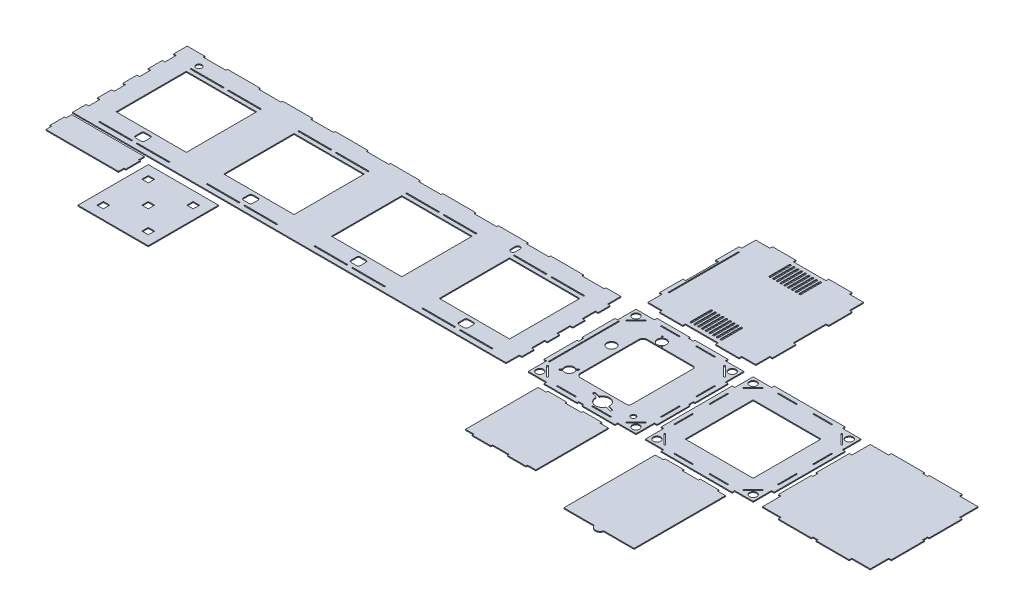
from build123d import *

# Parameters (mm, degrees)
BOSS_EXTRUDE1_DEPTH   = 2.54
SKETCH5_R             = 7.9375
SKETCH5_W             = 190.5
SKETCH5_H             = 3.1242
SKETCH5_H_2           = 190.5
CUT_EXTRUDE2_DEPTH    = 754.599861511
BOSS_EXTRUDE2_DEPTH   = 2.54
SKETCH6_W             = 184.15
SKETCH6_H             = 184.15
BOSS_EXTRUDE2_2_DEPTH = 2.54
BOSS_EXTRUDE2_3_DEPTH = 2.54
BOSS_EXTRUDE3_DEPTH   = 2.54
SKETCH8_R             = 10
CUT_EXTRUDE3_DEPTH    = 1442.914068337
SKETCH9_W             = 190.5
SKETCH9_H             = 190.5
SKETCH9_W_2           = 17.272
SKETCH9_H_2           = 17.272
BOSS_EXTRUDE4_DEPTH   = 2.54
SKETCH11_R            = 12.6875032
SKETCH11_R_2          = 1.7054957
SKETCH11_R_3          = 6.747379022
CUT_EXTRUDE4_DEPTH    = 1470.492237295
SKETCH12_W            = 2.921
SKETCH12_H            = 50.8
SKETCH12_W_2          = 50.8
SKETCH12_H_2          = 2.921
CUT_EXTRUDE5_DEPTH    = 1470.492237295
SKETCH13_W            = 2.921
SKETCH13_H            = 190.5
CUT_EXTRUDE6_DEPTH    = 1470.492237295
BOSS_EXTRUDE5_DEPTH   = 2.54
SKETCH14_W            = 2.921
SKETCH14_H            = 190.5
BOSS_EXTRUDE5_2_DEPTH = 2.54
BOSS_EXTRUDE5_3_DEPTH = 2.54
SKETCH15_W            = 61.214
SKETCH15_H            = 4.445
CUT_EXTRUDE7_DEPTH    = 1502.22101135
SKETCH16_W            = 12.7
SKETCH16_H            = 3.1242
BOSS_EXTRUDE6_DEPTH   = 2.54
SKETCH17_W            = 13.335
SKETCH17_H            = 4.445
SKETCH17_W_2          = 4.445
SKETCH17_H_2          = 13.335
CUT_EXTRUDE8_DEPTH    = 1502.22101135


with BuildPart() as part:
    # Sketch1 → Boss-Extrude1 (new body)
    with BuildSketch(Plane(origin=(0, 0, 0), x_dir=(1, 0, 0), z_dir=(0, 1, 0))):
        Polygon((146.05, 155.575), (438.15, 155.575), (438.15, 119.6594), (445.262, 119.6594), (445.262, 86.7664), (438.15, 86.7664), (438.15, 50.8508), (445.262, 50.8508), (445.262, 17.9578), (438.15, 17.9578), (438.15, -17.9578), (445.262, -17.9578), (445.262, -50.8508), (438.15, -50.8508), (438.15, -86.7664), (445.262, -86.7664), (445.262, -119.6594), (438.15, -119.6594), (438.15, -155.575), (146.05, -155.575), (-146.05, -155.575), (-438.15, -155.575), (-730.25, -155.575), (-737.362, -155.575), (-737.362, -118.4529), (-730.25, -118.4529), (-730.25, -87.9729), (-737.362, -87.9729), (-737.362, -49.6443), (-730.25, -49.6443), (-730.25, -19.1643), (-737.362, -19.1643), (-737.362, 19.1643), (-730.25, 19.1643), (-730.25, 49.6443), (-737.362, 49.6443), (-737.362, 87.9729), (-730.25, 87.9729), (-730.25, 118.4529), (-737.362, 118.4529), (-737.362, 155.575), (-730.25, 155.575), (-438.15, 155.575), (-146.05, 155.575), align=None)
    extrude(amount=BOSS_EXTRUDE1_DEPTH)

    # Sketch5 → Cut-Extrude2 (cut, through all)
    with BuildSketch(Plane(origin=(0, 2.54, 0), x_dir=(1, 0, 0), z_dir=(0, 1, 0))):
        with Locations((-673.862, 123.7742)):
            Circle(SKETCH5_R)
        with Locations((-584.2, -141.3129)):
            Rectangle(SKETCH5_W, SKETCH5_H)
        with Locations((-292.1, -141.3129)):
            Rectangle(SKETCH5_W, SKETCH5_H)
        with Locations((0, -141.3129)):
            Rectangle(SKETCH5_W, SKETCH5_H)
        with Locations((292.1, -141.3129)):
            Rectangle(SKETCH5_W, SKETCH5_H)
        with Locations((-584.2, 0)):
            Rectangle(SKETCH5_W, SKETCH5_H_2)
        with Locations((-292.1, 0)):
            Rectangle(SKETCH5_W, SKETCH5_H_2)
        Rectangle(SKETCH5_W, SKETCH5_H_2)
        with Locations((292.1, 0)):
            Rectangle(SKETCH5_W, SKETCH5_H_2)
        with Locations((-584.2, 106.9721)):
            Rectangle(SKETCH5_W, SKETCH5_H)
        with Locations((-292.1, 106.9721)):
            Rectangle(SKETCH5_W, SKETCH5_H)
        with Locations((0, 106.9721)):
            Rectangle(SKETCH5_W, SKETCH5_H)
        with Locations((292.1, 106.9721)):
            Rectangle(SKETCH5_W, SKETCH5_H)
        with BuildLine():
            Line((-7.62, -130.2258), (7.62, -130.2258))
            ThreePointArc((7.62, -130.2258), (11.212102448, -128.737902448), (12.7, -125.1458))
            Line((12.7, -125.1458), (12.7, -109.855))
            ThreePointArc((12.7, -109.855), (11.212102448, -106.262897552), (7.62, -104.775))
            Line((7.62, -104.775), (-7.62, -104.775))
            ThreePointArc((-7.62, -104.775), (-11.212102448, -106.262897552), (-12.7, -109.855))
            Line((-12.7, -109.855), (-12.7, -125.1458))
            ThreePointArc((-12.7, -125.1458), (-11.212102448, -128.737902448), (-7.62, -130.2258))
        make_face()
        with BuildLine():
            Line((-299.72, -104.775), (-284.48, -104.775))
            ThreePointArc((-284.48, -104.775), (-280.887897552, -106.262897552), (-279.4, -109.855))
            Line((-279.4, -109.855), (-279.4, -125.1458))
            ThreePointArc((-279.4, -125.1458), (-280.887897552, -128.737902448), (-284.48, -130.2258))
            Line((-284.48, -130.2258), (-299.72, -130.2258))
            ThreePointArc((-299.72, -130.2258), (-303.312102448, -128.737902448), (-304.8, -125.1458))
            Line((-304.8, -125.1458), (-304.8, -109.855))
            ThreePointArc((-304.8, -109.855), (-303.312102448, -106.262897552), (-299.72, -104.775))
        make_face()
        with BuildLine():
            Line((284.48, -130.2258), (299.72, -130.2258))
            ThreePointArc((299.72, -130.2258), (303.312102448, -128.737902448), (304.8, -125.1458))
            Line((304.8, -125.1458), (304.8, -109.855))
            ThreePointArc((304.8, -109.855), (303.312102448, -106.262897552), (299.72, -104.775))
            Line((299.72, -104.775), (284.48, -104.775))
            ThreePointArc((284.48, -104.775), (280.887897552, -106.262897552), (279.4, -109.855))
            Line((279.4, -109.855), (279.4, -125.1458))
            ThreePointArc((279.4, -125.1458), (280.887897552, -128.737902448), (284.48, -130.2258))
        make_face()
        with BuildLine():
            Line((-596.9, -109.855), (-596.9, -125.1458))
            ThreePointArc((-596.9, -125.1458), (-595.412102448, -128.737902448), (-591.82, -130.2258))
            Line((-591.82, -130.2258), (-576.58, -130.2258))
            ThreePointArc((-576.58, -130.2258), (-572.987897552, -128.737902448), (-571.5, -125.1458))
            Line((-571.5, -125.1458), (-571.5, -109.855))
            ThreePointArc((-571.5, -109.855), (-572.987897552, -106.262897552), (-576.58, -104.775))
            Line((-576.58, -104.775), (-591.82, -104.775))
            ThreePointArc((-591.82, -104.775), (-595.412102448, -106.262897552), (-596.9, -109.855))
        make_face()
        with BuildLine():
            Line((190.5, 130.1242), (190.5, 117.4242))
            ThreePointArc((190.5, 117.4242), (184.15, 111.0742), (177.8, 117.4242))
            Line((177.8, 117.4242), (177.8, 130.1242))
            ThreePointArc((177.8, 130.1242), (184.15, 136.4742), (190.5, 130.1242))
        make_face()
    extrude(amount=-CUT_EXTRUDE2_DEPTH, mode=Mode.SUBTRACT)

    # Sketch15 → Cut-Extrude7 (cut, through all)
    with BuildSketch(Plane(origin=(0, 2.54, 0), x_dir=(1, 0, 0), z_dir=(0, 1, 0))):
        with Locations((217.043, 153.3525)):
            Rectangle(SKETCH15_W, SKETCH15_H)
        with Locations((367.157, 153.3525)):
            Rectangle(SKETCH15_W, SKETCH15_H)
        with Locations((-75.057, 153.3525)):
            Rectangle(SKETCH15_W, SKETCH15_H)
        with Locations((75.057, 153.3525)):
            Rectangle(SKETCH15_W, SKETCH15_H)
        with Locations((-367.157, 153.3525)):
            Rectangle(SKETCH15_W, SKETCH15_H)
        with Locations((-217.043, 153.3525)):
            Rectangle(SKETCH15_W, SKETCH15_H)
        with Locations((-659.257, 153.3525)):
            Rectangle(SKETCH15_W, SKETCH15_H)
        with Locations((-509.143, 153.3525)):
            Rectangle(SKETCH15_W, SKETCH15_H)
    extrude(amount=-CUT_EXTRUDE7_DEPTH, mode=Mode.SUBTRACT)

    # Sketch16 → Boss-Extrude6 (add)
    with BuildSketch(Plane(origin=(0, 2.54, 0), x_dir=(1, 0, 0), z_dir=(0, 1, 0))):
        with Locations((-584.2, 106.9721)):
            Rectangle(SKETCH16_W, SKETCH16_H)
        with Locations((-292.1, 106.9721)):
            Rectangle(SKETCH16_W, SKETCH16_H)
        with Locations((-584.2, -141.3129)):
            Rectangle(SKETCH16_W, SKETCH16_H)
        with Locations((-292.1, -141.3129)):
            Rectangle(SKETCH16_W, SKETCH16_H)
        with Locations((0, 106.9721)):
            Rectangle(SKETCH16_W, SKETCH16_H)
        with Locations((0, -141.3129)):
            Rectangle(SKETCH16_W, SKETCH16_H)
        with Locations((292.1, 106.9721)):
            Rectangle(SKETCH16_W, SKETCH16_H)
        with Locations((292.1, -141.3129)):
            Rectangle(SKETCH16_W, SKETCH16_H)
    extrude(amount=-BOSS_EXTRUDE6_DEPTH)


with BuildPart() as body_2:
    # Sketch6 → Boss-Extrude2 (new body)
    with BuildSketch(Plane(origin=(0, 0, 0), x_dir=(1, 0, 0), z_dir=(0, 1, 0))):
        Polygon((488.95, 96.139), (488.95, 146.05), (538.861, 146.05), (538.861, 153.162), (731.139, 153.162), (731.139, 146.05), (781.05, 146.05), (781.05, 96.139), (788.162, 96.139), (788.162, -96.139), (781.05, -96.139), (781.05, -146.05), (731.139, -146.05), (731.139, -153.162), (538.861, -153.162), (538.861, -146.05), (488.95, -146.05), (488.95, -96.139), (481.838, -96.139), (481.838, 96.139), align=None)
    extrude(amount=BOSS_EXTRUDE2_DEPTH)


with BuildPart() as body_3:
    # Sketch6 → Boss-Extrude2 2 (new body)
    with BuildSketch(Plane(origin=(0, 0, 0), x_dir=(1, 0, 0), z_dir=(0, 1, 0))):
        Polygon((799.338, 96.139), (799.338, -96.139), (806.45, -96.139), (806.45, -146.05), (856.361, -146.05), (856.361, -153.162), (1048.639, -153.162), (1048.639, -146.05), (1098.55, -146.05), (1098.55, -96.139), (1105.662, -96.139), (1105.662, 96.139), (1098.55, 96.139), (1098.55, 146.05), (1048.639, 146.05), (1048.639, 153.162), (856.361, 153.162), (856.361, 146.05), (806.45, 146.05), (806.45, 96.139), align=None)
        with Locations((952.5, 0)):
            Rectangle(SKETCH6_W, SKETCH6_H, mode=Mode.SUBTRACT)
    extrude(amount=BOSS_EXTRUDE2_2_DEPTH)


with BuildPart() as body_4:
    # Sketch6 → Boss-Extrude2 3 (new body)
    with BuildSketch(Plane(origin=(0, 0, 0), x_dir=(1, 0, 0), z_dir=(0, 1, 0))):
        Polygon((1116.838, 96.139), (1116.838, -96.139), (1123.95, -96.139), (1123.95, -146.05), (1173.861, -146.05), (1173.861, -153.162), (1366.139, -153.162), (1366.139, -146.05), (1416.05, -146.05), (1416.05, -96.139), (1423.162, -96.139), (1423.162, 96.139), (1416.05, 96.139), (1416.05, 146.05), (1366.139, 146.05), (1366.139, 153.162), (1173.861, 153.162), (1173.861, 146.05), (1123.95, 146.05), (1123.95, 96.139), align=None)
    extrude(amount=BOSS_EXTRUDE2_3_DEPTH)


with BuildPart() as body_5:
    # Sketch7 → Boss-Extrude3 (new body)
    with BuildSketch(Plane(origin=(0, 0, 0), x_dir=(1, 0, 0), z_dir=(0, 1, 0))):
        Polygon((-732.917, -161.925), (-536.321, -161.925), (-536.321, -177.165), (-531.876, -177.165), (-531.876, -216.535), (-536.321, -216.535), (-536.321, -231.775), (-732.917, -231.775), (-732.917, -216.535), (-737.362, -216.535), (-737.362, -177.165), (-732.917, -177.165), align=None)
    extrude(amount=BOSS_EXTRUDE3_DEPTH)


with BuildPart() as cut_extrude3_tool:
    # Sketch8 → Cut-Extrude3 (new, through all)
    with BuildSketch(Plane(origin=(0, 2.54, 0), x_dir=(1, 0, 0), z_dir=(0, 1, 0))):
        with Locations((822.165448212, 130.334551788)):
            Circle(SKETCH8_R)
        with Locations((1082.834551788, 130.334551788)):
            Circle(SKETCH8_R)
        with Locations((1082.834551788, -130.334551788)):
            Circle(SKETCH8_R)
        with Locations((822.165448212, -130.334551788)):
            Circle(SKETCH8_R)
        with Locations((504.665448212, 130.334551788)):
            Circle(SKETCH8_R)
        with Locations((765.334551788, 130.334551788)):
            Circle(SKETCH8_R)
        with Locations((765.334551788, -130.334551788)):
            Circle(SKETCH8_R)
        with Locations((504.665448212, -130.334551788)):
            Circle(SKETCH8_R)
        Polygon((500.435115818, -107.624115818), (527.375884182, -134.564884182), (529.585027187, -132.355741176), (502.644258824, -105.414972813), align=None)
        Polygon((529.585027187, 132.355741176), (502.644258824, 105.414972813), (500.435115818, 107.624115818), (527.375884182, 134.564884182), align=None)
        Polygon((767.355741176, 105.414972813), (740.414972813, 132.355741176), (742.624115818, 134.564884182), (769.564884182, 107.624115818), align=None)
        Polygon((740.414972813, -132.355741176), (767.355741176, -105.414972813), (769.564884182, -107.624115818), (742.624115818, -134.564884182), align=None)
        Polygon((817.935115818, -107.624115818), (820.144258824, -105.414972813), (847.085027187, -132.355741176), (844.875884182, -134.564884182), align=None)
        Polygon((820.144258824, 105.414972813), (817.935115818, 107.624115818), (844.875884182, 134.564884182), (847.085027187, 132.355741176), align=None)
        Polygon((1057.914972813, 132.355741176), (1060.124115818, 134.564884182), (1087.064884182, 107.624115818), (1084.855741176, 105.414972813), align=None)
        Polygon((1084.855741176, -105.414972813), (1087.064884182, -107.624115818), (1060.124115818, -134.564884182), (1057.914972813, -132.355741176), align=None)
    extrude(amount=-CUT_EXTRUDE3_DEPTH)


with BuildPart() as body_2_1:
    add(body_2.part)

    # Cut-Extrude3: cut by cut_extrude3_tool
    add(cut_extrude3_tool.part, mode=Mode.SUBTRACT)

    # Sketch11 → Cut-Extrude4 (cut, through all)
    with BuildSketch(Plane(origin=(0, 2.54, 0), x_dir=(1, 0, 0), z_dir=(0, 1, 0))):
        with Locations((540.385, 28.067)):
            Circle(SKETCH11_R)
        with Locations((600.584397, 104.3237436)):
            Circle(SKETCH11_R)
        with Locations((612.380792, 93.3292393)):
            Circle(SKETCH11_R_2)
        with Locations((588.3905174, 117.3172406)):
            Circle(SKETCH11_R_2)
        with Locations((737.057200001, -109.220000002)):
            Circle(SKETCH11_R_3)
        with BuildLine():
            Line((679.001218905, -124.538259876), (690.502378135, -127.619986202))
            ThreePointArc((690.502378135, -127.619986202), (694.235400503, -125.464724733), (692.080139033, -121.731702364))
            Line((692.080139033, -121.731702364), (680.578979804, -118.649976037))
            ThreePointArc((680.578979804, -118.649976037), (679.882033046, -118.172215085), (679.639114424, -117.362906211))
            ThreePointArc((679.639114424, -117.362906211), (665.550382, -98.069523592), (643.702490503, -107.733716851))
            ThreePointArc((643.702490503, -107.733716851), (643.087462368, -108.313139585), (642.245008295, -108.378419327))
            Line((642.245008295, -108.378419327), (630.743849064, -105.296693))
            ThreePointArc((630.743849064, -105.296693), (627.010826696, -107.451954469), (629.166088165, -111.184976837))
            Line((629.166088165, -111.184976837), (640.667247395, -114.266703165))
            ThreePointArc((640.667247395, -114.266703165), (641.364194153, -114.744464117), (641.607112775, -115.553772991))
            ThreePointArc((641.607112775, -115.553772991), (652.618847339, -133.731389412), (673.606119056, -130.381992048))
            ThreePointArc((673.606119056, -130.381992048), (675.79922073, -127.952351108), (677.543736697, -125.182962351))
            ThreePointArc((677.543736697, -125.182962351), (678.158764831, -124.603539618), (679.001218905, -124.538259876))
        make_face()
        with BuildLine():
            Line((551.677072903, -78.533766145), (554.425437911, -75.785401137))
            ThreePointArc((554.425437911, -75.785401137), (554.425437911, -72.193298689), (550.833335463, -72.193298689))
            Line((550.833335463, -72.193298689), (548.084970455, -74.941663697))
            ThreePointArc((548.084970455, -74.941663697), (547.361951275, -75.30152232), (546.568159689, -75.15269396))
            ThreePointArc((546.568159689, -75.15269396), (531.414977451, -77.260920051), (529.30675136, -92.414102289))
            ThreePointArc((529.30675136, -92.414102289), (529.45557972, -93.207893875), (529.095721097, -93.930913055))
            Line((529.095721097, -93.930913055), (526.347356089, -96.679278063))
            ThreePointArc((526.347356089, -96.679278063), (526.347356089, -100.271380511), (529.939458537, -100.271380511))
            Line((529.939458537, -100.271380511), (532.687823545, -97.523015503))
            ThreePointArc((532.687823545, -97.523015503), (533.410842725, -97.16315688), (534.204634311, -97.31198524))
            ThreePointArc((534.204634311, -97.31198524), (549.357816549, -95.203759149), (551.46604264, -80.050576911))
            ThreePointArc((551.46604264, -80.050576911), (551.31721428, -79.256785325), (551.677072903, -78.533766145))
        make_face()
        with BuildLine():
            Line((699.863001735, 90.322743515), (574.863001758, 90.322743515))
            ThreePointArc((574.863001758, 90.322743515), (566.871456828, 87.01253722), (563.561250533, 79.02099229))
            Line((563.561250533, 79.02099229), (563.561250533, -78.979005984))
            ThreePointArc((563.561250533, -78.979005984), (566.871456828, -86.970550914), (574.863001758, -90.280757208))
            Line((574.863001758, -90.280757208), (699.863001735, -90.280757208))
            ThreePointArc((699.863001735, -90.280757208), (704.319011668, -88.435017459), (706.164751417, -83.979007526))
            Line((706.164751417, -83.979007526), (706.164751417, 84.020993832))
            ThreePointArc((706.164751417, 84.020993832), (704.319011668, 88.477003766), (699.863001735, 90.322743515))
        make_face()
    extrude(amount=-CUT_EXTRUDE4_DEPTH, mode=Mode.SUBTRACT)


with BuildPart() as body_3_1:
    add(body_3.part)

    # Cut-Extrude3: cut by cut_extrude3_tool
    add(cut_extrude3_tool.part, mode=Mode.SUBTRACT)


with BuildPart() as body_6:
    # Sketch9 → Boss-Extrude4 (new body)
    with BuildSketch(Plane(origin=(0, 0, 0), x_dir=(1, 0, 0), z_dir=(0, 1, 0))):
        with Locations((-416.626, -270.825)):
            Rectangle(SKETCH9_W, SKETCH9_H)
        with Locations((-416.626, -270.825)):
            Rectangle(SKETCH9_W_2, SKETCH9_H_2, mode=Mode.SUBTRACT)
        with Locations((-477.524727194, -209.926272806)):
            Rectangle(SKETCH9_W_2, SKETCH9_H_2, mode=Mode.SUBTRACT)
        with Locations((-477.524727194, -331.723727194)):
            Rectangle(SKETCH9_W_2, SKETCH9_H_2, mode=Mode.SUBTRACT)
        with Locations((-355.727272806, -331.723727194)):
            Rectangle(SKETCH9_W_2, SKETCH9_H_2, mode=Mode.SUBTRACT)
        with Locations((-355.727272806, -209.926272806)):
            Rectangle(SKETCH9_W_2, SKETCH9_H_2, mode=Mode.SUBTRACT)
    extrude(amount=BOSS_EXTRUDE4_DEPTH)


with BuildPart() as cut_extrude5_tool:
    # Sketch12 → Cut-Extrude5 (new, through all)
    with BuildSketch(Plane(origin=(0, 2.54, 0), x_dir=(1, 0, 0), z_dir=(0, 1, 0))):
        with Locations((494.0935, -47.621851794)):
            Rectangle(SKETCH12_W, SKETCH12_H)
        with Locations((494.0935, 47.628148206)):
            Rectangle(SKETCH12_W, SKETCH12_H)
        with Locations((682.628148206, 140.9065)):
            Rectangle(SKETCH12_W_2, SKETCH12_H_2)
        with Locations((587.378148206, 140.9065)):
            Rectangle(SKETCH12_W_2, SKETCH12_H_2)
        with Locations((775.9065, -47.628148206)):
            Rectangle(SKETCH12_W, SKETCH12_H)
        with Locations((775.9065, 47.621851794)):
            Rectangle(SKETCH12_W, SKETCH12_H)
        with Locations((587.371851794, -140.9065)):
            Rectangle(SKETCH12_W_2, SKETCH12_H_2)
        with Locations((682.621851794, -140.9065)):
            Rectangle(SKETCH12_W_2, SKETCH12_H_2)
        with Locations((811.5935, 47.628148206)):
            Rectangle(SKETCH12_W, SKETCH12_H)
        with Locations((811.5935, -47.621851794)):
            Rectangle(SKETCH12_W, SKETCH12_H)
        with Locations((1000.128148206, 140.9065)):
            Rectangle(SKETCH12_W_2, SKETCH12_H_2)
        with Locations((904.878148206, 140.9065)):
            Rectangle(SKETCH12_W_2, SKETCH12_H_2)
        with Locations((1093.4065, -47.628148206)):
            Rectangle(SKETCH12_W, SKETCH12_H)
        with Locations((1093.4065, 47.621851794)):
            Rectangle(SKETCH12_W, SKETCH12_H)
        with Locations((904.871851794, -140.9065)):
            Rectangle(SKETCH12_W_2, SKETCH12_H_2)
        with Locations((1000.121851794, -140.9065)):
            Rectangle(SKETCH12_W_2, SKETCH12_H_2)
    extrude(amount=-CUT_EXTRUDE5_DEPTH)


with BuildPart() as body_2_2:
    add(body_2_1.part)

    # Cut-Extrude5: cut by cut_extrude5_tool
    add(cut_extrude5_tool.part, mode=Mode.SUBTRACT)

    # Sketch13 → Cut-Extrude6 (cut, through all)
    with BuildSketch(Plane(origin=(0, 2.54, 0), x_dir=(1, 0, 0), z_dir=(0, 1, 0))):
        with Locations((494.0935, 0.003148206)):
            Rectangle(SKETCH13_W, SKETCH13_H)
    extrude(amount=-CUT_EXTRUDE6_DEPTH, mode=Mode.SUBTRACT)


with BuildPart() as body_3_2:
    add(body_3_1.part)

    # Cut-Extrude5: cut by cut_extrude5_tool
    add(cut_extrude5_tool.part, mode=Mode.SUBTRACT)


with BuildPart() as body_7:
    # Sketch14 → Boss-Extrude5 (new body)
    with BuildSketch(Plane(origin=(0, 0, 0), x_dir=(1, 0, 0), z_dir=(0, 1, 0))):
        Polygon((539.746851794, -170.307), (561.971851794, -170.307), (561.971851794, -165.862), (612.771851794, -165.862), (612.771851794, -170.307), (657.221851794, -170.307), (657.221851794, -165.862), (708.021851794, -165.862), (708.021851794, -170.307), (730.246851794, -170.307), (730.246851794, -366.903), (708.021851794, -366.903), (708.021851794, -371.348), (657.221851794, -371.348), (657.221851794, -366.903), (612.771851794, -366.903), (612.771851794, -371.348), (561.971851794, -371.348), (561.971851794, -366.903), (539.746851794, -366.903), align=None)
    extrude(amount=BOSS_EXTRUDE5_DEPTH)


with BuildPart() as body_8:
    # Sketch14 → Boss-Extrude5 2 (new body)
    with BuildSketch(Plane(origin=(0, 0, 0), x_dir=(1, 0, 0), z_dir=(0, 1, 0))):
        Polygon((488.95, 470.662), (527.05, 470.662), (527.05, 477.774), (590.55, 477.774), (590.55, 470.662), (679.45, 470.662), (679.45, 477.774), (742.95, 477.774), (742.95, 470.662), (781.05, 470.662), (781.05, 432.562), (788.162, 432.562), (788.162, 369.062), (781.05, 369.062), (781.05, 280.162), (788.162, 280.162), (788.162, 216.662), (781.05, 216.662), (781.05, 178.562), (742.95, 178.562), (742.95, 171.45), (679.45, 171.45), (679.45, 178.562), (590.55, 178.562), (590.55, 171.45), (527.05, 171.45), (527.05, 178.562), (488.95, 178.562), (488.95, 216.662), (481.838, 216.662), (481.838, 280.162), (488.95, 280.162), (488.95, 369.062), (481.838, 369.062), (481.838, 432.562), (488.95, 432.562), align=None)
        with BuildLine():
            Line((632.46, 244.9068), (632.46, 190.9318))
            ThreePointArc((632.46, 190.9318), (635, 188.3918), (637.54, 190.9318))
            Line((637.54, 190.9318), (637.54, 244.9068))
            ThreePointArc((637.54, 244.9068), (635, 247.4468), (632.46, 244.9068))
        make_face(mode=Mode.SUBTRACT)
        with BuildLine():
            Line((632.46, 404.3172), (632.46, 458.2922))
            ThreePointArc((632.46, 458.2922), (635, 460.8322), (637.54, 458.2922))
            Line((637.54, 458.2922), (637.54, 404.3172))
            ThreePointArc((637.54, 404.3172), (635, 401.7772), (632.46, 404.3172))
        make_face(mode=Mode.SUBTRACT)
        with BuildLine():
            Line((642.62, 404.3172), (642.62, 458.2922))
            ThreePointArc((642.62, 458.2922), (645.16, 460.8322), (647.7, 458.2922))
            Line((647.7, 458.2922), (647.7, 404.3172))
            ThreePointArc((647.7, 404.3172), (645.16, 401.7772), (642.62, 404.3172))
        make_face(mode=Mode.SUBTRACT)
        with BuildLine():
            Line((642.62, 244.9068), (642.62, 190.9318))
            ThreePointArc((642.62, 190.9318), (645.16, 188.3918), (647.7, 190.9318))
            Line((647.7, 190.9318), (647.7, 244.9068))
            ThreePointArc((647.7, 244.9068), (645.16, 247.4468), (642.62, 244.9068))
        make_face(mode=Mode.SUBTRACT)
        with BuildLine():
            Line((652.78, 404.3172), (652.78, 458.2922))
            ThreePointArc((652.78, 458.2922), (655.32, 460.8322), (657.86, 458.2922))
            Line((657.86, 458.2922), (657.86, 404.3172))
            ThreePointArc((657.86, 404.3172), (655.32, 401.7772), (652.78, 404.3172))
        make_face(mode=Mode.SUBTRACT)
        with BuildLine():
            Line((652.78, 244.9068), (652.78, 190.9318))
            ThreePointArc((652.78, 190.9318), (655.32, 188.3918), (657.86, 190.9318))
            Line((657.86, 190.9318), (657.86, 244.9068))
            ThreePointArc((657.86, 244.9068), (655.32, 247.4468), (652.78, 244.9068))
        make_face(mode=Mode.SUBTRACT)
        with BuildLine():
            Line((662.94, 404.3172), (662.94, 458.2922))
            ThreePointArc((662.94, 458.2922), (665.48, 460.8322), (668.02, 458.2922))
            Line((668.02, 458.2922), (668.02, 404.3172))
            ThreePointArc((668.02, 404.3172), (665.48, 401.7772), (662.94, 404.3172))
        make_face(mode=Mode.SUBTRACT)
        with BuildLine():
            Line((662.94, 244.9068), (662.94, 190.9318))
            ThreePointArc((662.94, 190.9318), (665.48, 188.3918), (668.02, 190.9318))
            Line((668.02, 190.9318), (668.02, 244.9068))
            ThreePointArc((668.02, 244.9068), (665.48, 247.4468), (662.94, 244.9068))
        make_face(mode=Mode.SUBTRACT)
        with BuildLine():
            Line((673.1, 404.3172), (673.1, 458.2922))
            ThreePointArc((673.1, 458.2922), (675.64, 460.8322), (678.18, 458.2922))
            Line((678.18, 458.2922), (678.18, 404.3172))
            ThreePointArc((678.18, 404.3172), (675.64, 401.7772), (673.1, 404.3172))
        make_face(mode=Mode.SUBTRACT)
        with BuildLine():
            Line((673.1, 244.9068), (673.1, 190.9318))
            ThreePointArc((673.1, 190.9318), (675.64, 188.3918), (678.18, 190.9318))
            Line((678.18, 190.9318), (678.18, 244.9068))
            ThreePointArc((678.18, 244.9068), (675.64, 247.4468), (673.1, 244.9068))
        make_face(mode=Mode.SUBTRACT)
        with BuildLine():
            Line((622.3, 404.3172), (622.3, 458.2922))
            ThreePointArc((622.3, 458.2922), (624.84, 460.8322), (627.38, 458.2922))
            Line((627.38, 458.2922), (627.38, 404.3172))
            ThreePointArc((627.38, 404.3172), (624.84, 401.7772), (622.3, 404.3172))
        make_face(mode=Mode.SUBTRACT)
        with BuildLine():
            Line((622.3, 244.9068), (622.3, 190.9318))
            ThreePointArc((622.3, 190.9318), (624.84, 188.3918), (627.38, 190.9318))
            Line((627.38, 190.9318), (627.38, 244.9068))
            ThreePointArc((627.38, 244.9068), (624.84, 247.4468), (622.3, 244.9068))
        make_face(mode=Mode.SUBTRACT)
        with BuildLine():
            Line((612.14, 404.3172), (612.14, 458.2922))
            ThreePointArc((612.14, 458.2922), (614.68, 460.8322), (617.22, 458.2922))
            Line((617.22, 458.2922), (617.22, 404.3172))
            ThreePointArc((617.22, 404.3172), (614.68, 401.7772), (612.14, 404.3172))
        make_face(mode=Mode.SUBTRACT)
        with BuildLine():
            Line((612.14, 244.9068), (612.14, 190.9318))
            ThreePointArc((612.14, 190.9318), (614.68, 188.3918), (617.22, 190.9318))
            Line((617.22, 190.9318), (617.22, 244.9068))
            ThreePointArc((617.22, 244.9068), (614.68, 247.4468), (612.14, 244.9068))
        make_face(mode=Mode.SUBTRACT)
        with BuildLine():
            Line((601.98, 404.3172), (601.98, 458.2922))
            ThreePointArc((601.98, 458.2922), (604.52, 460.8322), (607.06, 458.2922))
            Line((607.06, 458.2922), (607.06, 404.3172))
            ThreePointArc((607.06, 404.3172), (604.52, 401.7772), (601.98, 404.3172))
        make_face(mode=Mode.SUBTRACT)
        with BuildLine():
            Line((601.98, 244.9068), (601.98, 190.9318))
            ThreePointArc((601.98, 190.9318), (604.52, 188.3918), (607.06, 190.9318))
            Line((607.06, 190.9318), (607.06, 244.9068))
            ThreePointArc((607.06, 244.9068), (604.52, 247.4468), (601.98, 244.9068))
        make_face(mode=Mode.SUBTRACT)
        with BuildLine():
            Line((591.82, 404.3172), (591.82, 458.2922))
            ThreePointArc((591.82, 458.2922), (594.36, 460.8322), (596.9, 458.2922))
            Line((596.9, 458.2922), (596.9, 404.3172))
            ThreePointArc((596.9, 404.3172), (594.36, 401.7772), (591.82, 404.3172))
        make_face(mode=Mode.SUBTRACT)
        with BuildLine():
            Line((591.82, 244.9068), (591.82, 190.9318))
            ThreePointArc((591.82, 190.9318), (594.36, 188.3918), (596.9, 190.9318))
            Line((596.9, 190.9318), (596.9, 244.9068))
            ThreePointArc((596.9, 244.9068), (594.36, 247.4468), (591.82, 244.9068))
        make_face(mode=Mode.SUBTRACT)
        with Locations((494.0935, 324.612)):
            Rectangle(SKETCH14_W, SKETCH14_H, mode=Mode.SUBTRACT)
    extrude(amount=BOSS_EXTRUDE5_2_DEPTH)


with BuildPart() as body_9:
    # Sketch14 → Boss-Extrude5 3 (new body)
    with BuildSketch(Plane(origin=(0, 0, 0), x_dir=(1, 0, 0), z_dir=(0, 1, 0))):
        with BuildLine():
            Line((857.25, -170.307), (879.471851794, -170.307))
            Line((879.471851794, -170.307), (879.471851794, -165.862))
            Line((879.471851794, -165.862), (930.271851794, -165.862))
            Line((930.271851794, -165.862), (930.271851794, -170.307))
            Line((930.271851794, -170.307), (974.721851794, -170.307))
            Line((974.721851794, -170.307), (974.721851794, -165.862))
            Line((974.721851794, -165.862), (1025.521851794, -165.862))
            Line((1025.521851794, -165.862), (1025.521851794, -170.307))
            Line((1025.521851794, -170.307), (1047.75, -170.307))
            Line((1047.75, -170.307), (1047.75, -417.957))
            Line((1047.75, -417.957), (965.2, -417.957))
            ThreePointArc((965.2, -417.957), (952.5, -427.785458995), (939.8, -417.957))
            Line((939.8, -417.957), (857.25, -417.957))
            Line((857.25, -417.957), (857.25, -170.307))
        make_face()
    extrude(amount=BOSS_EXTRUDE5_3_DEPTH)


with BuildPart() as cut_extrude8_tool:
    # Sketch17 → Cut-Extrude8 (new, through all)
    with BuildSketch(Plane(origin=(0, 2.54, 0), x_dir=(1, 0, 0), z_dir=(0, 1, 0))):
        with Locations((635, 150.9395)):
            Rectangle(SKETCH17_W, SKETCH17_H)
        with Locations((635, -150.9395)):
            Rectangle(SKETCH17_W, SKETCH17_H)
        with Locations((484.0605, 0)):
            Rectangle(SKETCH17_W_2, SKETCH17_H_2)
        with Locations((785.9395, 0)):
            Rectangle(SKETCH17_W_2, SKETCH17_H_2)
        with Locations((1119.0605, 0)):
            Rectangle(SKETCH17_W_2, SKETCH17_H_2)
        with Locations((1270, -150.9395)):
            Rectangle(SKETCH17_W, SKETCH17_H)
        with Locations((1420.9395, 0)):
            Rectangle(SKETCH17_W_2, SKETCH17_H_2)
        with Locations((1270, 150.9395)):
            Rectangle(SKETCH17_W, SKETCH17_H)
    extrude(amount=-CUT_EXTRUDE8_DEPTH)


with BuildPart() as body_2_3:
    add(body_2_2.part)

    # Cut-Extrude8: cut by cut_extrude8_tool
    add(cut_extrude8_tool.part, mode=Mode.SUBTRACT)


with BuildPart() as body_4_1:
    add(body_4.part)

    # Cut-Extrude8: cut by cut_extrude8_tool
    add(cut_extrude8_tool.part, mode=Mode.SUBTRACT)


solid = Compound([part.part, body_5.part, body_6.part, body_3_2.part, body_7.part, body_8.part, body_9.part, body_2_3.part, body_4_1.part])
